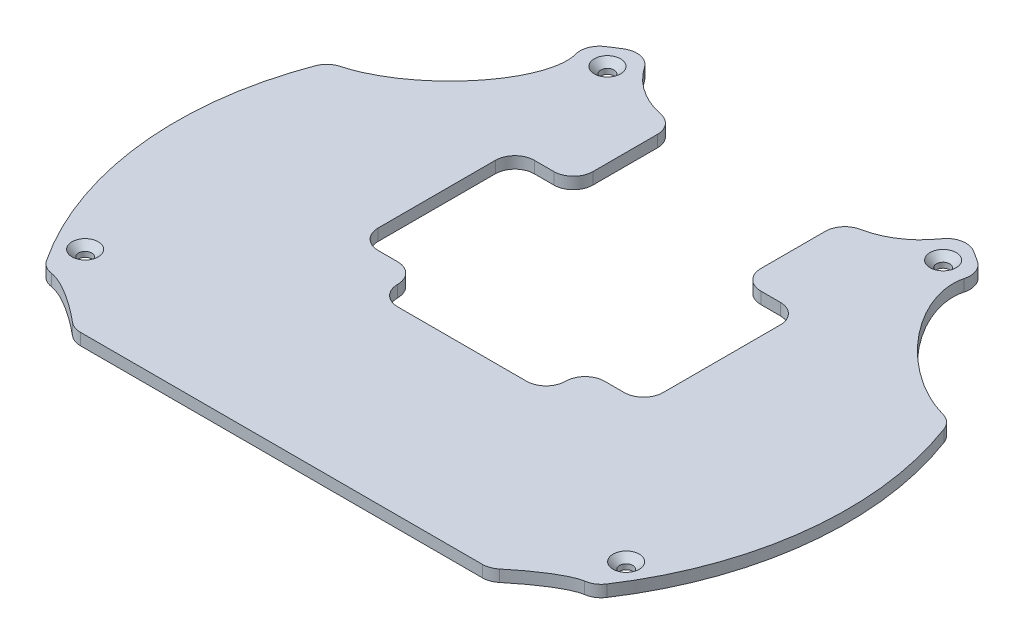
from build123d import *

# Parameters (mm, degrees)
RESSALTO_EXTRUS_O2_DEPTH            = 3
ESCAREADO_PARA_SFHCS_M31_AT_2_COUNT = 2
ESCAREADO_PARA_SFHCS_M31_AT_2_PITCH = 110.642088925
ESCAREADO_PARA_SFHCS_M31_AT_3_COUNT = 2
ESCAREADO_PARA_SFHCS_M31_AT_3_PITCH = 155.41473117
ESCAREADO_PARA_SFHCS_M31_AT_4_COUNT = 2
ESCAREADO_PARA_SFHCS_M31_AT_4_PITCH = 85.967937335
FILETE4_R                           = 5
FILETE6_R                           = 5
FILETE7_R                           = 5
FILETE8_R                           = 5


with BuildPart() as part:
    # Esboço3 → Ressalto-extrusão2 (new body)
    with BuildSketch(Plane(origin=(0, 0, 0), x_dir=(1, 0, 0), z_dir=(0, 1, 0))):
        with BuildLine():
            Line((-21.5, 63.269141943), (-21.5, 37.269141943))
            Line((-21.5, 37.269141943), (-36.5, 37.269141943))
            Line((-36.5, 37.269141943), (-36.5, -2.730858057))
            Line((-36.5, -2.730858057), (-21.5, -2.730858057))
            Line((-21.5, -2.730858057), (-21.5, -12.730858057))
            Line((-21.5, -12.730858057), (21.5, -12.730858057))
            Line((21.5, -12.730858057), (21.5, -2.730858057))
            Line((21.5, -2.730858057), (36.5, -2.730858057))
            Line((36.5, -2.730858057), (36.5, 37.269141943))
            Line((36.5, 37.269141943), (21.5, 37.269141943))
            Line((21.5, 37.269141943), (21.5, 63.269141943))
            ThreePointArc((21.5, 63.269141943), (32.805831499, 66.771318629), (40.152161049, 76.051324532))
            ThreePointArc((40.152161049, 76.051324532), (45.878189612, 72.740578208), (51.332841832, 68.999560502))
            add(Edge.make_bspline(
                [(51.332841832, 68.999560502), (24.845967814, 40.579122115), (79.509348747, 32.775958595)],
                knots=[0, 0, 0, 2.519003886, 2.519003886, 2.519003886], degree=2, weights=[1, 0.306291066, 1]))
            ThreePointArc((79.509348747, 32.775958595), (85.434712449, -9.844283047), (69.971422738, -50))
            add(Edge.make_bspline(
                [(69.971422738, -50), (67.189039214, -47.047402145), (53.286638173, -59)],
                knots=[3.141592654, 3.141592654, 3.141592654, 4.504907102, 4.504907102, 4.504907102], degree=2, weights=[1, 0.776529601, 1]))
            Line((53.286638173, -59), (-53.286638173, -59))
            add(Edge.make_bspline(
                [(-53.286638173, -59), (-67.189039214, -47.047402145), (-69.971422738, -50)],
                knots=[1.778278205, 1.778278205, 1.778278205, 3.141592654, 3.141592654, 3.141592654], degree=2, weights=[1, 0.776529601, 1]))
            ThreePointArc((-69.971422738, -50), (-85.434712449, -9.844283047), (-79.509348747, 32.775958595))
            add(Edge.make_bspline(
                [(-79.509348747, 32.775958595), (-24.845967814, 40.579122115), (-51.332841832, 68.999560502)],
                knots=[0.622588768, 0.622588768, 0.622588768, 3.141592654, 3.141592654, 3.141592654], degree=2, weights=[1, 0.306291066, 1]))
            ThreePointArc((-51.332841832, 68.999560502), (-45.878189612, 72.740578208), (-40.152161049, 76.051324532))
            ThreePointArc((-40.152161049, 76.051324532), (-32.805831499, 66.771318629), (-21.5, 63.269141943))
        make_face()
    extrude(amount=RESSALTO_EXTRUS_O2_DEPTH)

    # Esboço12 → Escareado para SFHCS M31 (revolve, cut)
    with BuildSketch(Plane(origin=(42.983968668, 3, -67.471315665), x_dir=(0, 0, 1), z_dir=(1, 0, 0))):
        Polygon((0, 0), (0, 3), (1.7, 3), (1.7, 1.66), (3.36, 0), align=None)
    escareado_para_sfhcs_m31 = revolve(axis=Axis((42.983968668, 9.35, -67.471315665), (0, -1, 0)), mode=Mode.SUBTRACT)

    # Escareado para SFHCS M31 at 2: Escareado para SFHCS M31 ×2
    with Locations(*[Vector(0.23768589232617374, 0, 0.9713420698132613) * (i * ESCAREADO_PARA_SFHCS_M31_AT_2_PITCH) for i in range(1, ESCAREADO_PARA_SFHCS_M31_AT_2_COUNT)]):
        add(escareado_para_sfhcs_m31, mode=Mode.SUBTRACT)

    # Escareado para SFHCS M31 at 3: Escareado para SFHCS M31 ×2
    with Locations(*[Vector(-0.7223639620597521, 0, 0.6915130557822732) * (i * ESCAREADO_PARA_SFHCS_M31_AT_3_PITCH) for i in range(1, ESCAREADO_PARA_SFHCS_M31_AT_3_COUNT)]):
        add(escareado_para_sfhcs_m31, mode=Mode.SUBTRACT)

    # Escareado para SFHCS M31 at 4: Escareado para SFHCS M31 ×2
    with Locations(*[(-i * ESCAREADO_PARA_SFHCS_M31_AT_4_PITCH, 0, 0) for i in range(1, ESCAREADO_PARA_SFHCS_M31_AT_4_COUNT)]):
        add(escareado_para_sfhcs_m31, mode=Mode.SUBTRACT)

    # Filete4
    filete4_edges = [part.edges().sort_by_distance(p)[0] for p in [
        (21.5, 1.5, -63.269141943),
        (40.152161049, 1.5, -76.051324532),
        (-40.152161049, 1.5, -76.051324532),
        (-21.5, 1.5, -63.269141943),
    ]]
    fillet(filete4_edges, radius=FILETE4_R)

    # Filete6
    filete6_edges = [part.edges().sort_by_distance(p)[0] for p in [
        (69.971422738, 1.5, 50),
        (53.286638173, 1.5, 59),
        (-53.286638173, 1.5, 59),
        (-69.971422738, 1.5, 50),
    ]]
    fillet(filete6_edges, radius=FILETE6_R)

    # Filete7
    filete7_edges = [part.edges().sort_by_distance(p)[0] for p in [
        (-21.5, 1.5, 12.730858057),
        (21.5, 1.5, 12.730858057),
        (21.5, 1.5, 2.730858057),
        (36.5, 1.5, 2.730858057),
        (36.5, 1.5, -37.269141943),
        (21.5, 1.5, -37.269141943),
        (-21.5, 1.5, -37.269141943),
        (-36.5, 1.5, -37.269141943),
        (-36.5, 1.5, 2.730858057),
        (-21.5, 1.5, 2.730858057),
    ]]
    fillet(filete7_edges, radius=FILETE7_R - 0.0001)  # a hair under: the kernel refuses the full size

    # Filete8
    filete8_edges = [part.edges().sort_by_distance(p)[0] for p in [
        (79.509348747, 1.5, -32.775958595),
        (51.332841832, 1.5, -68.999560502),
        (-79.509348747, 1.5, -32.775958595),
        (-51.332841832, 1.5, -68.999560502),
    ]]
    fillet(filete8_edges, radius=FILETE8_R)


solid = part.part
